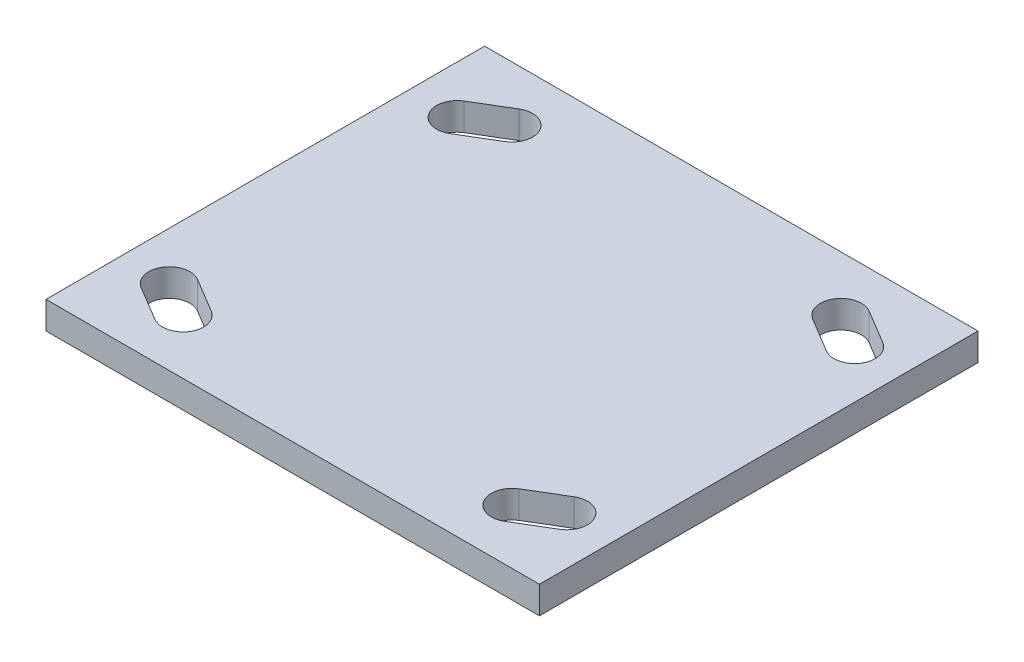
from build123d import *

# Parameters (mm, degrees)
SKETCH1_W           = 114.3
SKETCH1_H           = 6.35
BOSS_EXTRUDE1_DEPTH = 50.8
F_1_2_HOLES_DEPTH   = 77.727341932


with BuildPart() as part:
    # Sketch1 → Boss-Extrude1 (new, symmetric)
    with BuildSketch(Plane.XY):
        with Locations((0, -3.175)):
            Rectangle(SKETCH1_W, SKETCH1_H)
    extrude(amount=BOSS_EXTRUDE1_DEPTH, both=True)

    # Sketch2 → 1-2 holes (cut, through all)
    with BuildSketch(Plane(origin=(0, 0, 0), x_dir=(1, 0, 0), z_dir=(0, 1, 0))):
        with BuildLine():
            Line((-35.649713965, 34.016189941), (-43.587213965, 29.253689941))
            ThreePointArc((-43.587213965, 29.253689941), (-50.121310059, 30.887213965), (-48.487786035, 37.421310059))
            Line((-48.487786035, 37.421310059), (-40.550286035, 42.183810059))
            ThreePointArc((-40.550286035, 42.183810059), (-34.016189941, 40.550286035), (-35.649713965, 34.016189941))
        make_face()
        with BuildLine():
            Line((-35.649713965, -34.016189941), (-43.587213965, -29.253689941))
            ThreePointArc((-43.587213965, -29.253689941), (-50.121310059, -30.887213965), (-48.487786035, -37.421310059))
            Line((-48.487786035, -37.421310059), (-40.550286035, -42.183810059))
            ThreePointArc((-40.550286035, -42.183810059), (-34.016189941, -40.550286035), (-35.649713965, -34.016189941))
        make_face()
        with BuildLine():
            Line((35.649713965, 34.016189941), (43.587213965, 29.253689941))
            ThreePointArc((43.587213965, 29.253689941), (50.121310059, 30.887213965), (48.487786035, 37.421310059))
            Line((48.487786035, 37.421310059), (40.550286035, 42.183810059))
            ThreePointArc((40.550286035, 42.183810059), (34.016189941, 40.550286035), (35.649713965, 34.016189941))
        make_face()
        with BuildLine():
            Line((35.649713965, -34.016189941), (43.587213965, -29.253689941))
            ThreePointArc((43.587213965, -29.253689941), (50.121310059, -30.887213965), (48.487786035, -37.421310059))
            Line((48.487786035, -37.421310059), (40.550286035, -42.183810059))
            ThreePointArc((40.550286035, -42.183810059), (34.016189941, -40.550286035), (35.649713965, -34.016189941))
        make_face()
    extrude(amount=-F_1_2_HOLES_DEPTH, mode=Mode.SUBTRACT)


solid = part.part
